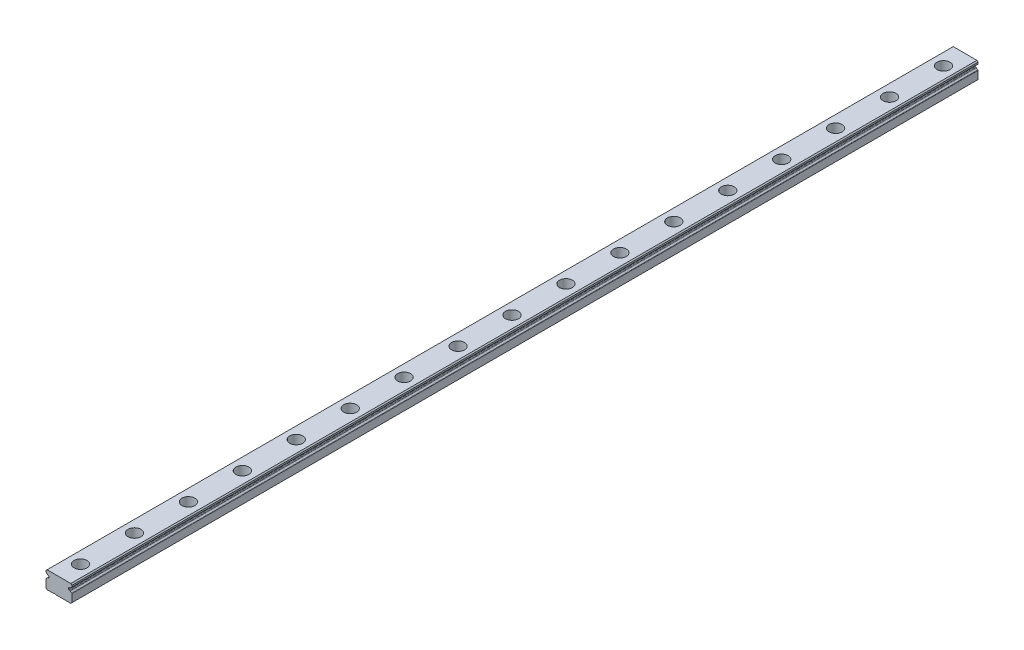
from build123d import *

# Parameters (mm, degrees)
BOSS_EXTRUDE1_DEPTH = 420
SKETCH2_R           = 1.75
CUT_EXTRUDE1_DEPTH  = 421.119030714
SKETCH2_3_R         = 3
CUT_EXTRUDE2_DEPTH  = 4.5


with BuildPart() as part:
    # Sketch1 → Boss-Extrude1 (new body)
    with BuildSketch(Plane.XY):
        with BuildLine():
            Line((5.5, -7.999998), (6, -7.499998))
            Line((6, -7.499998), (6, -3.85787958))
            ThreePointArc((6, -3.85787958), (5.9576137, -3.718608076), (5.844827586, -3.626562203))
            ThreePointArc((5.844827586, -3.626562203), (5.51524529, -3.424071402), (5.267205011, -3.12724985))
            ThreePointArc((5.267205011, -3.12724985), (5.185241933, -3.042985123), (5.073828324, -3.005495145))
            Line((5.073828324, -3.005495145), (4.728211064, -2.975257553))
            ThreePointArc((4.728211064, -2.975257553), (4.565680666, -2.89510643), (4.5, -2.726208878))
            Line((4.5, -2.726208878), (4.5, -2.273787121))
            ThreePointArc((4.5, -2.273787121), (4.565680666, -2.10488957), (4.728211064, -2.024738447))
            Line((4.728211064, -2.024738447), (5.09477657, -1.992668121))
            ThreePointArc((5.09477657, -1.992668121), (5.203244499, -1.957004425), (5.284541491, -1.876829678))
            ThreePointArc((5.284541491, -1.876829678), (5.527906161, -1.597614221), (5.844827586, -1.405915383))
            ThreePointArc((5.844827586, -1.405915383), (5.9576137, -1.31386951), (6, -1.174598006))
            Line((6, -1.174598006), (6, -0.5))
            Line((6, -0.5), (5.5, 0))
            Line((5.5, 0), (-5.5, 0))
            Line((-5.5, 0), (-6, -0.5))
            Line((-6, -0.5), (-6, -1.174598006))
            ThreePointArc((-6, -1.174598006), (-5.9576137, -1.31386951), (-5.844827586, -1.405915383))
            ThreePointArc((-5.844827586, -1.405915383), (-5.527906161, -1.597614221), (-5.284541491, -1.876829678))
            ThreePointArc((-5.284541491, -1.876829678), (-5.203244499, -1.957004425), (-5.09477657, -1.992668121))
            Line((-5.09477657, -1.992668121), (-4.728211064, -2.024738447))
            ThreePointArc((-4.728211064, -2.024738447), (-4.565680666, -2.10488957), (-4.5, -2.273787121))
            Line((-4.5, -2.273787121), (-4.5, -2.726208878))
            ThreePointArc((-4.5, -2.726208878), (-4.565680666, -2.89510643), (-4.728211064, -2.975257553))
            Line((-4.728211064, -2.975257553), (-5.073828324, -3.005495145))
            ThreePointArc((-5.073828324, -3.005495145), (-5.185241932, -3.042985123), (-5.267205011, -3.12724985))
            ThreePointArc((-5.267205011, -3.12724985), (-5.51524529, -3.424071402), (-5.844827586, -3.626562203))
            ThreePointArc((-5.844827586, -3.626562203), (-5.9576137, -3.718608076), (-6, -3.85787958))
            Line((-6, -3.85787958), (-6, -7.499998))
            Line((-6, -7.499998), (-5.5, -7.999998))
            Line((-5.5, -7.999998), (-2.4, -7.999998))
            ThreePointArc((-2.4, -7.999998), (-2, -7.799998), (-1.6, -7.999998))
            Line((-1.6, -7.999998), (5.5, -7.999998))
        make_face()
    extrude(amount=BOSS_EXTRUDE1_DEPTH)

    # Sketch2 → Cut-Extrude1 (cut, through all)
    with BuildSketch(Plane(origin=(0, 0, 0), x_dir=(1, 0, 0), z_dir=(0, 1, 0))):
        with Locations((0, -10)):
            Circle(SKETCH2_R)
        with Locations((0, -35)):
            Circle(SKETCH2_R)
        with Locations((0, -60)):
            Circle(SKETCH2_R)
        with Locations((0, -85)):
            Circle(SKETCH2_R)
        with Locations((0, -110)):
            Circle(SKETCH2_R)
        with Locations((0, -135)):
            Circle(SKETCH2_R)
        with Locations((0, -160)):
            Circle(SKETCH2_R)
        with Locations((0, -185)):
            Circle(SKETCH2_R)
        with Locations((0, -210)):
            Circle(SKETCH2_R)
        with Locations((0, -235)):
            Circle(SKETCH2_R)
        with Locations((0, -260)):
            Circle(SKETCH2_R)
        with Locations((0, -285)):
            Circle(SKETCH2_R)
        with Locations((0, -310)):
            Circle(SKETCH2_R)
        with Locations((0, -335)):
            Circle(SKETCH2_R)
        with Locations((0, -360)):
            Circle(SKETCH2_R)
        with Locations((0, -385)):
            Circle(SKETCH2_R)
        with Locations((0, -410)):
            Circle(SKETCH2_R)
    extrude(amount=-CUT_EXTRUDE1_DEPTH, mode=Mode.SUBTRACT)

    # Sketch2<3> → Cut-Extrude2 (cut)
    with BuildSketch(Plane(origin=(0, 0, 0), x_dir=(1, 0, 0), z_dir=(0, 1, 0))):
        with Locations((0, -10)):
            Circle(SKETCH2_3_R)
        with Locations((0, -35)):
            Circle(SKETCH2_3_R)
        with Locations((0, -60)):
            Circle(SKETCH2_3_R)
        with Locations((0, -85)):
            Circle(SKETCH2_3_R)
        with Locations((0, -110)):
            Circle(SKETCH2_3_R)
        with Locations((0, -135)):
            Circle(SKETCH2_3_R)
        with Locations((0, -160)):
            Circle(SKETCH2_3_R)
        with Locations((0, -185)):
            Circle(SKETCH2_3_R)
        with Locations((0, -210)):
            Circle(SKETCH2_3_R)
        with Locations((0, -235)):
            Circle(SKETCH2_3_R)
        with Locations((0, -260)):
            Circle(SKETCH2_3_R)
        with Locations((0, -285)):
            Circle(SKETCH2_3_R)
        with Locations((0, -310)):
            Circle(SKETCH2_3_R)
        with Locations((0, -335)):
            Circle(SKETCH2_3_R)
        with Locations((0, -360)):
            Circle(SKETCH2_3_R)
        with Locations((0, -385)):
            Circle(SKETCH2_3_R)
        with Locations((0, -410)):
            Circle(SKETCH2_3_R)
    extrude(amount=-CUT_EXTRUDE2_DEPTH, mode=Mode.SUBTRACT)


solid = part.part
